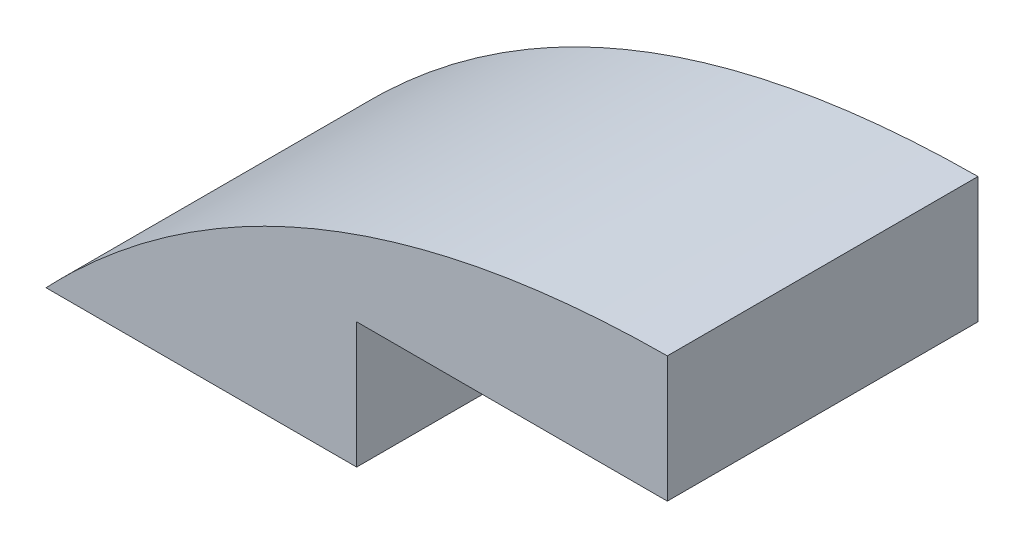
from build123d import *

# Parameters (mm, degrees)
SKETCH2_W           = 7.9
SKETCH2_H           = 7.9
BOSS_EXTRUDE1_DEPTH = 3.2
SKETCH3_W           = 7.9
SKETCH3_H           = 7.9
BOSS_EXTRUDE2_DEPTH = 3.2
SKETCH7_W           = 7.9
SKETCH7_H           = 3.2
BOSS_EXTRUDE5_DEPTH = 7.2
CUT_EXTRUDE2_DEPTH  = 8.2


with BuildPart() as part:
    # Sketch2 → Boss-Extrude1 (new body)
    with BuildSketch(Plane(origin=(0, 0, 0), x_dir=(1, 0, 0), z_dir=(0, 1, 0))):
        with Locations((3.95, 3.95)):
            Rectangle(SKETCH2_W, SKETCH2_H)
    extrude(amount=BOSS_EXTRUDE1_DEPTH)



with BuildPart() as body_2:
    # Sketch3 → Boss-Extrude2 (new body)
    with BuildSketch(Plane(origin=(0, 3.2, 0), x_dir=(1, 0, 0), z_dir=(0, 1, 0))):
        with Locations((11.85, 3.95)):
            Rectangle(SKETCH3_W, SKETCH3_H)
    extrude(amount=BOSS_EXTRUDE2_DEPTH)


with BuildPart() as part_1:
    add(part.part)

    add(body_2.part)  # Boss-Extrude5 merges body 2
    # Sketch7 → Boss-Extrude5 (add)
    with BuildSketch(Plane.ZY.offset(-7.9)):
        with Locations((-3.95, 4.8)):
            Rectangle(SKETCH7_W, SKETCH7_H)
    extrude(amount=BOSS_EXTRUDE5_DEPTH)

    # Sketch4 → Cut-Extrude2 (cut)
    with BuildSketch(Plane(origin=(0, 0, -7.9), x_dir=(-1, 0, 0), z_dir=(0, 0, -1))):
        with BuildLine():
            Line((-15.8, 6.4), (0, 6.4))
            Line((0, 6.4), (0, 0))
            add(Edge.make_bspline(
                [(-15.8, 6.4), (-6.036041783, 6.340151862), (0, 0)],
                knots=[0, 0, 0, 1, 1, 1], degree=2))
        make_face()
    extrude(amount=-CUT_EXTRUDE2_DEPTH, mode=Mode.SUBTRACT)


solid = part_1.part
